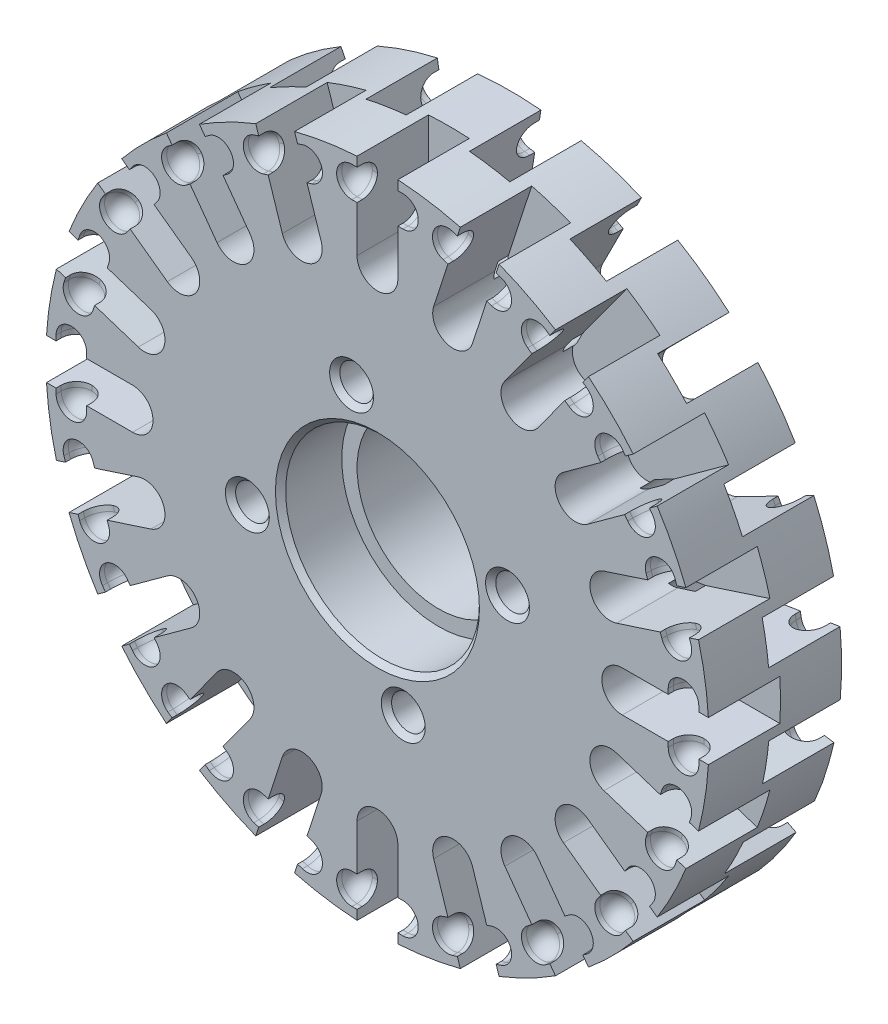
from build123d import *

# Parameters (mm, degrees)
SKETCH_1_R                        = 32.5
EXTRUDE_1_DEPTH                   = 13
SKETCH_10_R                       = 8
CUT_EXTRUDE_524_DEPTH             = 13
SKETCH_2_R                        = 9.5
CUT_EXTRUDE_1418_DEPTH            = 6
SKETCH_3_R                        = 1.65
CUT_EXTRUDE_1563_DEPTH            = 10
PATTERN_CIRCULAR_1_COUNT          = 4
CUT_EXTRUDE_START                 = -7
CUT_EXTRUDE_1_DEPTH               = 7
PATTERN_CIRCULAR_3_COUNT          = 20
CHAMFER_1_SIZE                    = 0.5
CUT_EXTRUDE_1_2_DEPTH             = 2
FILLET_3_R                        = 1.5
PATTERN_CIRCULAR_6_COUNT          = 20
FILLET_3_OF_PATTERN_CIRCULAR_6_R  = 1.5
CUT_EXTRUDE_START_2               = 48.765049984
CUT_EXTRUDE_2_DEPTH               = 55.765049984
PATTERN_CIRCULAR_8_COUNT          = 20
CUT_EXTRUDE_2_2_DEPTH             = 2
FILLET_4_R                        = 1.5
PATTERN_CIRCULAR_11_COUNT         = 20
FILLET_4_OF_PATTERN_CIRCULAR_11_R = 1.5


with BuildPart() as part:
    # 草图1 → 拉伸1 (new body)
    with BuildSketch(Plane.XY):
        with Locations(Location((0, 0, 0), (0, 0, 180))):
            Circle(SKETCH_1_R)
    extrude(amount=EXTRUDE_1_DEPTH)

    # 草图10 → Cut-Extrude 524 (cut)
    with BuildSketch(Plane.XY.offset(13)):
        Circle(SKETCH_10_R)
    extrude(amount=-CUT_EXTRUDE_524_DEPTH, mode=Mode.SUBTRACT)

    # 草图2 → Cut-Extrude 1418 (cut)
    with BuildSketch(Plane.XY.offset(13)):
        Circle(SKETCH_2_R)
    extrude(amount=-CUT_EXTRUDE_1418_DEPTH, mode=Mode.SUBTRACT)

    # 草图3 → Cut-Extrude 1563 (cut)
    with BuildSketch(Plane.XY.offset(13)):
        with Locations((-2.536174186, 12.750208645)):
            Circle(SKETCH_3_R)
    cut_extrude_1563 = extrude(amount=-CUT_EXTRUDE_1563_DEPTH, mode=Mode.SUBTRACT)

    # 阵列(圆周)1: Cut-Extrude 1563 ×4 about axis
    pattern_circular_1_axis = Axis((0, 0, 0), (0, 0, 1))
    for i in range(1, PATTERN_CIRCULAR_1_COUNT):
        add(cut_extrude_1563.rotate(pattern_circular_1_axis, i * 360 / PATTERN_CIRCULAR_1_COUNT), mode=Mode.SUBTRACT)

    # 草图5 → Cut-Extrude 1 (cut)
    with BuildSketch(Plane.XY.offset(13).offset(CUT_EXTRUDE_START)):
        with BuildLine():
            Line((-24, 2), (-32.438403167, 2))
            ThreePointArc((-32.438403167, 2), (-32.5, 0), (-32.438403167, -2))
            Line((-32.438403167, -2), (-24, -2))
            ThreePointArc((-24, -2), (-22, 0), (-24, 2))
        make_face()
    cut_extrude_1 = extrude(amount=CUT_EXTRUDE_1_DEPTH, mode=Mode.SUBTRACT)

    # 阵列(圆周)3: Cut-Extrude 1 ×20 about axis
    pattern_circular_3_axis = Axis((0, 0, 0), (0, 0, 1))
    for i in range(1, PATTERN_CIRCULAR_3_COUNT):
        add(cut_extrude_1.rotate(pattern_circular_3_axis, i * 360 / PATTERN_CIRCULAR_3_COUNT), mode=Mode.SUBTRACT)

    # 倒角1
    chamfer_1_edges = [part.edges().sort_by_distance(p)[0] for p in [
        (-9.5, 0, 13),
        (-4.186174186, 12.750208645, 13),
        (-12.750208645, -4.186174186, 13),
        (4.186174186, -12.750208645, 13),
        (12.750208645, 4.186174186, 13),
    ]]
    chamfer(chamfer_1_edges, length=CHAMFER_1_SIZE)

    # 草图15 → Cut-Extrude 1 2 (cut)
    with BuildSketch(Plane.XY.offset(13)):
        with BuildLine():
            Line((-31.5, 2.5), (-31.5, -2.5))
            ThreePointArc((-31.5, -2.5), (-30, -4), (-28.5, -2.5))
            Line((-28.5, -2.5), (-28.5, 2.5))
            ThreePointArc((-28.5, 2.5), (-30, 4), (-31.5, 2.5))
        make_face()
    cut_extrude_1_2 = extrude(amount=-CUT_EXTRUDE_1_2_DEPTH, mode=Mode.SUBTRACT)

    # 圆角3
    fillet_3_edges = [part.edges().sort_by_distance(p)[0] for p in [
        (-28.5, -2.25, 11),
        (-28.5, 2.25, 11),
        (-31.5, -2.25, 11),
        (-31.5, 2.25, 11),
        (-30, -4, 11),
        (-30, 4, 11),
    ]]
    fillet(fillet_3_edges, radius=FILLET_3_R - 0.0001)  # a hair under: the kernel refuses the full size

    # 阵列(圆周)6: Cut-Extrude 1 2 ×20 about axis
    pattern_circular_6_axis = Axis((0, 0, 0), (0, 0, 1))
    for i in range(1, PATTERN_CIRCULAR_6_COUNT):
        add(cut_extrude_1_2.rotate(pattern_circular_6_axis, i * 360 / PATTERN_CIRCULAR_6_COUNT), mode=Mode.SUBTRACT)

    # 圆角3 of 阵列(圆周)6
    fillet_3_of_pattern_circular_6_edges = [part.edges().sort_by_distance(p)[0] for p in [
        (-26.409822477, -10.946861501, 11),
        (-27.800398952, -6.667107178, 11),
        (-29.262992026, -11.873912484, 11),
        (-30.653568501, -7.594158161, 11),
        (-27.295627511, -13.074735896, 11),
        (-29.767763466, -5.466283766, 11),
        (-21.734467522, -18.572167928, 11),
        (-24.379501157, -14.931591453, 11),
        (-24.161518505, -20.335523685, 11),
        (-26.80655214, -16.69494721, 11),
        (-21.919368822, -20.869625546, 11),
        (-26.62165084, -14.397489591, 11),
        (-14.931591453, -24.379501157, 11),
        (-18.572167928, -21.734467522, 11),
        (-16.69494721, -26.80655214, 11),
        (-20.335523685, -24.161518505, 11),
        (-14.397489591, -26.62165084, 11),
        (-20.869625546, -21.919368822, 11),
        (-6.667107178, -27.800398952, 11),
        (-10.946861501, -26.409822477, 11),
        (-7.594158161, -30.653568501, 11),
        (-11.873912484, -29.262992026, 11),
        (-5.466283766, -29.767763466, 11),
        (-13.074735896, -27.295627511, 11),
        (2.25, -28.5, 11),
        (-2.25, -28.5, 11),
        (2.25, -31.5, 11),
        (-2.25, -31.5, 11),
        (4, -30, 11),
        (-4, -30, 11),
        (10.946861501, -26.409822477, 11),
        (6.667107178, -27.800398952, 11),
        (11.873912484, -29.262992026, 11),
        (7.594158161, -30.653568501, 11),
        (13.074735896, -27.295627511, 11),
        (5.466283766, -29.767763466, 11),
        (18.572167928, -21.734467522, 11),
        (14.931591453, -24.379501157, 11),
        (20.335523685, -24.161518505, 11),
        (16.69494721, -26.80655214, 11),
        (20.869625546, -21.919368822, 11),
        (14.397489591, -26.62165084, 11),
        (24.379501157, -14.931591453, 11),
        (21.734467522, -18.572167928, 11),
        (26.80655214, -16.69494721, 11),
        (24.161518505, -20.335523685, 11),
        (26.62165084, -14.397489591, 11),
        (21.919368822, -20.869625546, 11),
        (27.800398952, -6.667107178, 11),
        (26.409822477, -10.946861501, 11),
        (30.653568501, -7.594158161, 11),
        (29.262992026, -11.873912484, 11),
        (29.767763466, -5.466283766, 11),
        (27.295627511, -13.074735896, 11),
        (28.5, 2.25, 11),
        (28.5, -2.25, 11),
        (31.5, 2.25, 11),
        (31.5, -2.25, 11),
        (30, 4, 11),
        (30, -4, 11),
        (26.409822477, 10.946861501, 11),
        (27.800398952, 6.667107178, 11),
        (29.262992026, 11.873912484, 11),
        (30.653568501, 7.594158161, 11),
        (27.295627511, 13.074735896, 11),
        (29.767763466, 5.466283766, 11),
        (21.734467522, 18.572167928, 11),
        (24.379501157, 14.931591453, 11),
        (24.161518505, 20.335523685, 11),
        (26.80655214, 16.69494721, 11),
        (21.919368822, 20.869625546, 11),
        (26.62165084, 14.397489591, 11),
        (14.931591453, 24.379501157, 11),
        (18.572167928, 21.734467522, 11),
        (16.69494721, 26.80655214, 11),
        (20.335523685, 24.161518505, 11),
        (14.397489591, 26.62165084, 11),
        (20.869625546, 21.919368822, 11),
        (6.667107178, 27.800398952, 11),
        (10.946861501, 26.409822477, 11),
        (7.594158161, 30.653568501, 11),
        (11.873912484, 29.262992026, 11),
        (5.466283766, 29.767763466, 11),
        (13.074735896, 27.295627511, 11),
        (-2.25, 28.5, 11),
        (2.25, 28.5, 11),
        (-2.25, 31.5, 11),
        (2.25, 31.5, 11),
        (-4, 30, 11),
        (4, 30, 11),
        (-10.946861501, 26.409822477, 11),
        (-6.667107178, 27.800398952, 11),
        (-11.873912484, 29.262992026, 11),
        (-7.594158161, 30.653568501, 11),
        (-13.074735896, 27.295627511, 11),
        (-5.466283766, 29.767763466, 11),
        (-18.572167928, 21.734467522, 11),
        (-14.931591453, 24.379501157, 11),
        (-20.335523685, 24.161518505, 11),
        (-16.69494721, 26.80655214, 11),
        (-20.869625546, 21.919368822, 11),
        (-14.397489591, 26.62165084, 11),
        (-24.379501157, 14.931591453, 11),
        (-21.734467522, 18.572167928, 11),
        (-26.80655214, 16.69494721, 11),
        (-24.161518505, 20.335523685, 11),
        (-26.62165084, 14.397489591, 11),
        (-21.919368822, 20.869625546, 11),
        (-27.800398952, 6.667107178, 11),
        (-26.409822477, 10.946861501, 11),
        (-30.653568501, 7.594158161, 11),
        (-29.262992026, 11.873912484, 11),
        (-29.767763466, 5.466283766, 11),
        (-27.295627511, 13.074735896, 11),
    ]]
    fillet(fillet_3_of_pattern_circular_6_edges, radius=FILLET_3_OF_PATTERN_CIRCULAR_6_R - 0.0001)  # a hair under: the kernel refuses the full size

    # 草图22 → Cut-Extrude 2 (cut)
    with BuildSketch(Plane(origin=(0, 0, 0), x_dir=(-1, 0, 0), z_dir=(0, 0, -1)).offset(CUT_EXTRUDE_START_2)):
        with BuildLine():
            Line((28.034646568, 16.441064193), (20.506741739, 12.628283463))
            ThreePointArc((20.506741739, 12.628283463), (19.626213984, 9.940408676), (22.314088771, 9.059880921))
            Line((22.314088771, 9.059880921), (29.8419936, 12.87266165))
            ThreePointArc((29.8419936, 12.87266165), (28.993270658, 14.684694635), (28.034646568, 16.441064193))
        make_face()
    cut_extrude_2 = extrude(amount=-CUT_EXTRUDE_2_DEPTH, mode=Mode.SUBTRACT)

    # 阵列(圆周)8: Cut-Extrude 2 ×20 about axis
    pattern_circular_8_axis = Axis((0, 0, 0), (0, 0, 1))
    for i in range(1, PATTERN_CIRCULAR_8_COUNT):
        add(cut_extrude_2.rotate(pattern_circular_8_axis, i * 360 / PATTERN_CIRCULAR_8_COUNT), mode=Mode.SUBTRACT)

    # 草图23 → Cut-Extrude 2 2 (cut)
    with BuildSketch(Plane(origin=(0, 0, 0), x_dir=(-1, 0, 0), z_dir=(0, 0, -1))):
        with BuildLine():
            Line((28.544925839, 1.920210624), (27.77468566, 6.860527422))
            ThreePointArc((27.77468566, 6.860527422), (29.025708645, 8.573694515), (30.738875738, 7.32267153))
            Line((30.738875738, 7.32267153), (31.509115918, 2.382354732))
            ThreePointArc((31.509115918, 2.382354732), (30.258092932, 0.669187638), (28.544925839, 1.920210624))
        make_face()
    cut_extrude_2_2 = extrude(amount=-CUT_EXTRUDE_2_2_DEPTH, mode=Mode.SUBTRACT)

    # 圆角4
    fillet_4_edges = [part.edges().sort_by_distance(p)[0] for p in [
        (-28.50641383, 2.167226464, 2),
        (-31.470603909, 2.629370572, 2),
        (-30.258092932, 0.669187638, 2),
        (-27.813197669, 6.613511582, 2),
        (-30.777387747, 7.07565569, 2),
        (-29.025708645, 8.573694515, 2),
    ]]
    fillet(fillet_4_edges, radius=FILLET_4_R - 0.0001)  # a hair under: the kernel refuses the full size

    # 阵列(圆周)11: Cut-Extrude 2 2 ×20 about axis
    pattern_circular_11_axis = Axis((0, 0, 0), (0, 0, 1))
    for i in range(1, PATTERN_CIRCULAR_11_COUNT):
        add(cut_extrude_2_2.rotate(pattern_circular_11_axis, i * 360 / PATTERN_CIRCULAR_11_COUNT), mode=Mode.SUBTRACT)

    # 圆角4 of 阵列(圆周)11
    fillet_4_of_pattern_circular_11_edges = [part.edges().sort_by_distance(p)[0] for p in [
        (-27.780920437, -6.747811471, 2),
        (-30.742843111, -7.224271415, 2),
        (-28.983946807, -8.713829669, 2),
        (-28.495610353, -2.304927462, 2),
        (-31.457533026, -2.781387405, 2),
        (-30.254506657, -0.815369207, 2),
        (-24.336036991, -15.002326605, 2),
        (-27.00575863, -16.370751381, 2),
        (-24.872650025, -17.243876616, 2),
        (-26.388674156, -10.997744146, 2),
        (-29.058395795, -12.366168922, 2),
        (-28.521782762, -10.124618911, 2),
        (-18.508972685, -21.788309483, 2),
        (-20.625162335, -23.914748141, 2),
        (-18.32664496, -24.085972775, 2),
        (-21.698630671, -18.614025008, 2),
        (-23.814820322, -20.740463665, 2),
        (-23.997148047, -18.442800374, 2),
        (-10.870121173, -26.441500821, 2),
        (-12.225631447, -29.117802728, 2),
        (-9.986700198, -28.570366101, 2),
        (-14.884574033, -24.40823541, 2),
        (-16.240084307, -27.084537317, 2),
        (-17.123505283, -24.955672037, 2),
        (-2.167226464, -28.50641383, 2),
        (-2.629370572, -31.470603909, 2),
        (-0.669187638, -30.258092932, 2),
        (-6.613511582, -27.813197669, 2),
        (-7.07565569, -30.777387747, 2),
        (-8.573694515, -29.025708645, 2),
        (6.747811471, -27.780920437, 2),
        (7.224271415, -30.742843111, 2),
        (8.713829669, -28.983946807, 2),
        (2.304927462, -28.495610353, 2),
        (2.781387405, -31.457533026, 2),
        (0.815369207, -30.254506657, 2),
        (15.002326605, -24.336036991, 2),
        (16.370751381, -27.00575863, 2),
        (17.243876616, -24.872650025, 2),
        (10.997744146, -26.388674156, 2),
        (12.366168922, -29.058395795, 2),
        (10.124618911, -28.521782762, 2),
        (21.788309483, -18.508972685, 2),
        (23.914748141, -20.625162335, 2),
        (24.085972775, -18.32664496, 2),
        (18.614025008, -21.698630671, 2),
        (20.740463665, -23.814820322, 2),
        (18.442800374, -23.997148047, 2),
        (26.441500821, -10.870121173, 2),
        (29.117802728, -12.225631447, 2),
        (28.570366101, -9.986700198, 2),
        (24.40823541, -14.884574033, 2),
        (27.084537317, -16.240084307, 2),
        (24.955672037, -17.123505283, 2),
        (28.50641383, -2.167226464, 2),
        (31.470603909, -2.629370572, 2),
        (30.258092932, -0.669187638, 2),
        (27.813197669, -6.613511582, 2),
        (30.777387747, -7.07565569, 2),
        (29.025708645, -8.573694515, 2),
        (27.780920437, 6.747811471, 2),
        (30.742843111, 7.224271415, 2),
        (28.983946807, 8.713829669, 2),
        (28.495610353, 2.304927462, 2),
        (31.457533026, 2.781387405, 2),
        (30.254506657, 0.815369207, 2),
        (24.336036991, 15.002326605, 2),
        (27.00575863, 16.370751381, 2),
        (24.872650025, 17.243876616, 2),
        (26.388674156, 10.997744146, 2),
        (29.058395795, 12.366168922, 2),
        (28.521782762, 10.124618911, 2),
        (18.508972685, 21.788309483, 2),
        (20.625162335, 23.914748141, 2),
        (18.32664496, 24.085972775, 2),
        (21.698630671, 18.614025008, 2),
        (23.814820322, 20.740463665, 2),
        (23.997148047, 18.442800374, 2),
        (10.870121173, 26.441500821, 2),
        (12.225631447, 29.117802728, 2),
        (9.986700198, 28.570366101, 2),
        (14.884574033, 24.40823541, 2),
        (16.240084307, 27.084537317, 2),
        (17.123505283, 24.955672037, 2),
        (2.167226464, 28.50641383, 2),
        (2.629370572, 31.470603909, 2),
        (0.669187638, 30.258092932, 2),
        (6.613511582, 27.813197669, 2),
        (7.07565569, 30.777387747, 2),
        (8.573694515, 29.025708645, 2),
        (-6.747811471, 27.780920437, 2),
        (-7.224271415, 30.742843111, 2),
        (-8.713829669, 28.983946807, 2),
        (-2.304927462, 28.495610353, 2),
        (-2.781387405, 31.457533026, 2),
        (-0.815369207, 30.254506657, 2),
        (-15.002326605, 24.336036991, 2),
        (-16.370751381, 27.00575863, 2),
        (-17.243876616, 24.872650025, 2),
        (-10.997744146, 26.388674156, 2),
        (-12.366168922, 29.058395795, 2),
        (-10.124618911, 28.521782762, 2),
        (-21.788309483, 18.508972685, 2),
        (-23.914748141, 20.625162335, 2),
        (-24.085972775, 18.32664496, 2),
        (-18.614025008, 21.698630671, 2),
        (-20.740463665, 23.814820322, 2),
        (-18.442800374, 23.997148047, 2),
        (-26.441500821, 10.870121173, 2),
        (-29.117802728, 12.225631447, 2),
        (-28.570366101, 9.986700198, 2),
        (-24.40823541, 14.884574033, 2),
        (-27.084537317, 16.240084307, 2),
        (-24.955672037, 17.123505283, 2),
    ]]
    fillet(fillet_4_of_pattern_circular_11_edges, radius=FILLET_4_OF_PATTERN_CIRCULAR_11_R - 0.0001)  # a hair under: the kernel refuses the full size


solid = part.part
